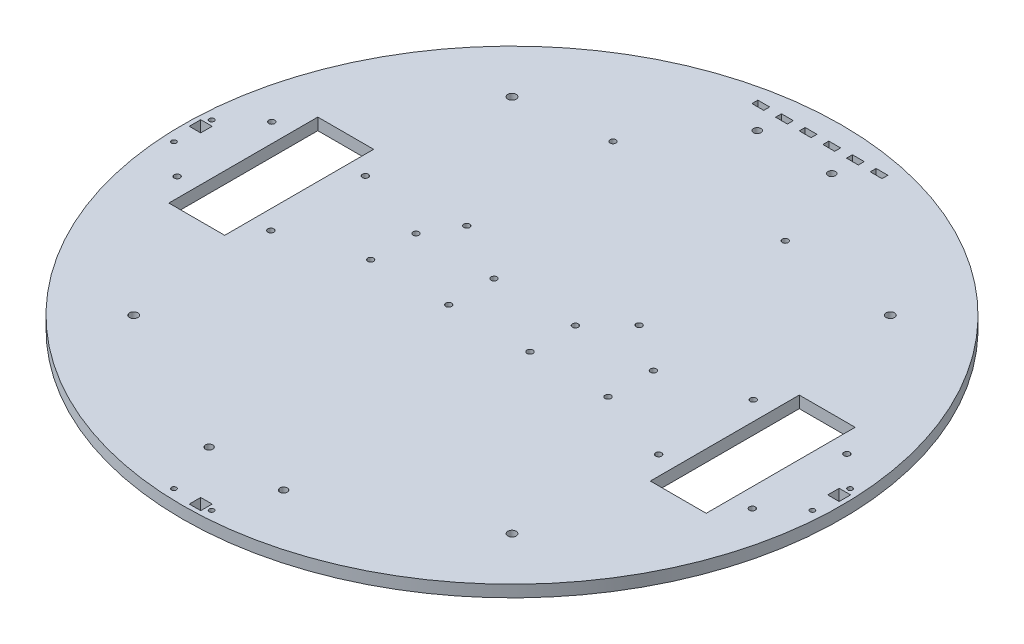
from build123d import *

# Parameters (mm, degrees)
SKETCH1_R           = 177
SKETCH1_R_2         = 1.6
SKETCH1_R_3         = 2.2479
SKETCH1_R_4         = 2.000000064
SKETCH1_R_5         = 1.3
SKETCH1_R_6         = 1.29999994
SKETCH1_W           = 6.15
SKETCH1_H           = 6.15
SKETCH1_W_2         = 30
SKETCH1_H_2         = 80
SKETCH1_W_3         = 6.35
SKETCH1_H_3         = 3.175
BOSS_EXTRUDE1_DEPTH = 6.35


with BuildPart() as part:
    # Sketch1 → Boss-Extrude1 (new body)
    with BuildSketch(Plane(origin=(0, 0, 0), x_dir=(1, 0, 0), z_dir=(0, 1, 0))):
        Circle(SKETCH1_R)
        with Locations((-154.46, 25.4)):
            Circle(SKETCH1_R_2, mode=Mode.SUBTRACT)
        with Locations((-154.46, -25.4)):
            Circle(SKETCH1_R_2, mode=Mode.SUBTRACT)
        with Locations((154.46, 25.4)):
            Circle(SKETCH1_R_2, mode=Mode.SUBTRACT)
        with Locations((154.46, -25.4)):
            Circle(SKETCH1_R_2, mode=Mode.SUBTRACT)
        with Locations((-104.14, 25.4)):
            Circle(SKETCH1_R_2, mode=Mode.SUBTRACT)
        with Locations((-104.14, -25.4)):
            Circle(SKETCH1_R_2, mode=Mode.SUBTRACT)
        with Locations((104.14, 25.4)):
            Circle(SKETCH1_R_2, mode=Mode.SUBTRACT)
        with Locations((104.14, -25.4)):
            Circle(SKETCH1_R_2, mode=Mode.SUBTRACT)
        with Locations((-53.7, 107.95)):
            Circle(SKETCH1_R_2, mode=Mode.SUBTRACT)
        with Locations((38.8, 107.95)):
            Circle(SKETCH1_R_2, mode=Mode.SUBTRACT)
        with Locations((-53.7, 29.45)):
            Circle(SKETCH1_R_2, mode=Mode.SUBTRACT)
        with Locations((38.8, 29.45)):
            Circle(SKETCH1_R_2, mode=Mode.SUBTRACT)
        with Locations((-101.6, -101.6)):
            Circle(SKETCH1_R_3, mode=Mode.SUBTRACT)
        with Locations((101.6, -101.6)):
            Circle(SKETCH1_R_3, mode=Mode.SUBTRACT)
        with Locations((-101.6, 101.6)):
            Circle(SKETCH1_R_3, mode=Mode.SUBTRACT)
        with Locations((101.6, 101.6)):
            Circle(SKETCH1_R_3, mode=Mode.SUBTRACT)
        with Locations((-20, -142.687006289)):
            Circle(SKETCH1_R_4, mode=Mode.SUBTRACT)
        with Locations((20, -142.687006289)):
            Circle(SKETCH1_R_4, mode=Mode.SUBTRACT)
        with Locations((-20, 151.719279026)):
            Circle(SKETCH1_R_4, mode=Mode.SUBTRACT)
        with Locations((20, 151.719279026)):
            Circle(SKETCH1_R_4, mode=Mode.SUBTRACT)
        with Locations((-10.125, -171.45)):
            Circle(SKETCH1_R_5, mode=Mode.SUBTRACT)
        with Locations((10.125, -171.45)):
            Circle(SKETCH1_R_6, mode=Mode.SUBTRACT)
        with Locations((171.45, -10.125)):
            Circle(SKETCH1_R_5, mode=Mode.SUBTRACT)
        with Locations((171.45, 10.125)):
            Circle(SKETCH1_R_5, mode=Mode.SUBTRACT)
        with Locations((-171.45, -10.125)):
            Circle(SKETCH1_R_5, mode=Mode.SUBTRACT)
        with Locations((-171.45, 10.125)):
            Circle(SKETCH1_R_5, mode=Mode.SUBTRACT)
        with Locations((-63.76, 12.204)):
            Circle(SKETCH1_R_2, mode=Mode.SUBTRACT)
        with Locations((-63.76, -12.18)):
            Circle(SKETCH1_R_2, mode=Mode.SUBTRACT)
        with Locations((-21.85, 12.204)):
            Circle(SKETCH1_R_2, mode=Mode.SUBTRACT)
        with Locations((-21.85, -12.18)):
            Circle(SKETCH1_R_2, mode=Mode.SUBTRACT)
        with Locations((63.76, -12.18)):
            Circle(SKETCH1_R_2, mode=Mode.SUBTRACT)
        with Locations((21.85, -12.18)):
            Circle(SKETCH1_R_2, mode=Mode.SUBTRACT)
        with Locations((21.85, 12.204)):
            Circle(SKETCH1_R_2, mode=Mode.SUBTRACT)
        with Locations((63.76, 12.204)):
            Circle(SKETCH1_R_2, mode=Mode.SUBTRACT)
        with Locations((171.45, 4.26)):
            Rectangle(SKETCH1_W, SKETCH1_H, mode=Mode.SUBTRACT)
        with Locations((-129.3, 0)):
            Rectangle(SKETCH1_W_2, SKETCH1_H_2, mode=Mode.SUBTRACT)
        with Locations((129.3, 0)):
            Rectangle(SKETCH1_W_2, SKETCH1_H_2, mode=Mode.SUBTRACT)
        with Locations((4.26, -171.45)):
            Rectangle(SKETCH1_W, SKETCH1_H, mode=Mode.SUBTRACT)
        with Locations((-171.45, 4.26)):
            Rectangle(SKETCH1_W, SKETCH1_H, mode=Mode.SUBTRACT)
        with Locations((-18.119952608, 164.452014647)):
            Rectangle(SKETCH1_W_3, SKETCH1_H_3, mode=Mode.SUBTRACT)
        with Locations((-30.819952608, 164.452014647)):
            Rectangle(SKETCH1_W_3, SKETCH1_H_3, mode=Mode.SUBTRACT)
        with Locations((-5.419952608, 164.452014647)):
            Rectangle(SKETCH1_W_3, SKETCH1_H_3, mode=Mode.SUBTRACT)
        with Locations((7.280047392, 164.452014647)):
            Rectangle(SKETCH1_W_3, SKETCH1_H_3, mode=Mode.SUBTRACT)
        with Locations((19.980047392, 164.452014647)):
            Rectangle(SKETCH1_W_3, SKETCH1_H_3, mode=Mode.SUBTRACT)
        with Locations((32.680047392, 164.452014647)):
            Rectangle(SKETCH1_W_3, SKETCH1_H_3, mode=Mode.SUBTRACT)
    extrude(amount=BOSS_EXTRUDE1_DEPTH)


solid = part.part
